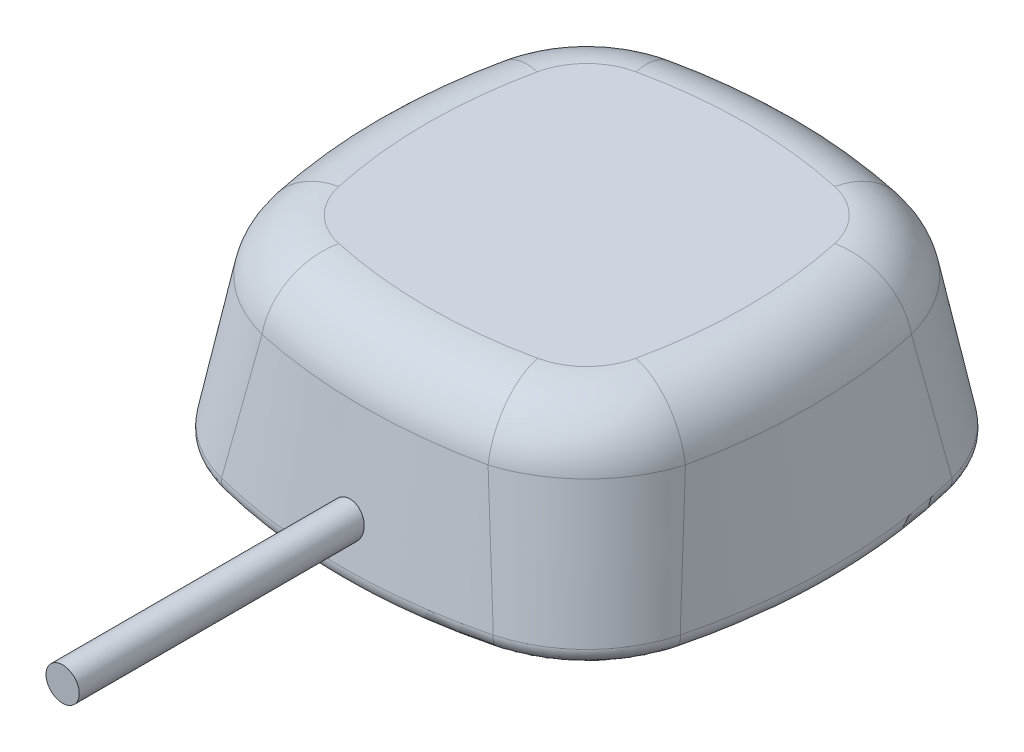
from build123d import *

# Parameters (mm, degrees)
BOSS_EXTRUDE1_DEPTH = 15
DRAFT1_ANGLE        = -10
FILLET1_R           = 10
FILLET2_R           = 5
FILLET3_R           = 1
SKETCH2_R           = 1.27
BOSS_EXTRUDE2_DEPTH = 40


with BuildPart() as part:
    # Sketch1 → Boss-Extrude1 (new body)
    with BuildSketch(Plane(origin=(0, 0, 0), x_dir=(1, 0, 0), z_dir=(0, 1, 0))):
        with BuildLine():
            ThreePointArc((-15.909902577, 15.909902577), (-19, 0), (-15.909902577, -15.909902577))
            ThreePointArc((-15.909902577, -15.909902577), (0, -19), (15.909902577, -15.909902577))
            ThreePointArc((15.909902577, -15.909902577), (19, 0), (15.909902577, 15.909902577))
            ThreePointArc((15.909902577, 15.909902577), (0, 19), (-15.909902577, 15.909902577))
        make_face()
    extrude(amount=BOSS_EXTRUDE1_DEPTH)

    # Draft1
    draft1_faces = [part.faces().sort_by_distance(p)[0] for p in [
        (0, 7.5, 19),
        (-19, 7.5, 0),
        (0, 7.5, -19),
        (19, 7.5, 0),
    ]]
    draft(draft1_faces, Plane(origin=(11.751247623, 0, 11.751247623), x_dir=(0, 0, -1), z_dir=(0, -1, 0)), DRAFT1_ANGLE)

    # Fillet1
    fillet1_edges = [part.edges().sort_by_distance(p)[0] for p in [
        (-14.890825178, 7.500840423, 14.890825178),
        (14.890825178, 7.500840423, 14.890825178),
        (14.890825178, 7.500840423, -14.890825178),
        (-14.890825178, 7.500840423, -14.890825178),
    ]]
    fillet(fillet1_edges, radius=FILLET1_R)

    # Fillet2
    fillet2_edges = [part.edges().sort_by_distance(p)[0] for p in [
        (-12.885422798, 15, 12.8854228),
        (-16.355095289, 15, 0),
        (-12.8854228, 15, -12.885422798),
        (0, 15, -16.355095289),
        (12.885422798, 15, -12.8854228),
        (16.355095289, 15, 0),
        (12.885422798, 15, 12.8854228),
        (0, 15, 16.355095289),
    ]]
    fillet(fillet2_edges, radius=FILLET2_R)

    # Fillet3
    fillet3_edges = [part.edges().sort_by_distance(p)[0] for p in [
        (-15.091189529, 0, 15.091189529),
        (-19, 0, 0),
        (-15.091189529, 0, -15.091189529),
        (0, 0, -19),
        (15.091189529, 0, -15.091189529),
        (19, 0, 0),
        (15.091189529, 0, 15.091189529),
        (0, 0, 19),
    ]]
    fillet(fillet3_edges, radius=FILLET3_R)

    # Sketch2 → Boss-Extrude2 (add)
    with BuildSketch(Plane.XY):
        with Locations((0, 4)):
            Circle(SKETCH2_R)
    extrude(amount=BOSS_EXTRUDE2_DEPTH)


solid = part.part
